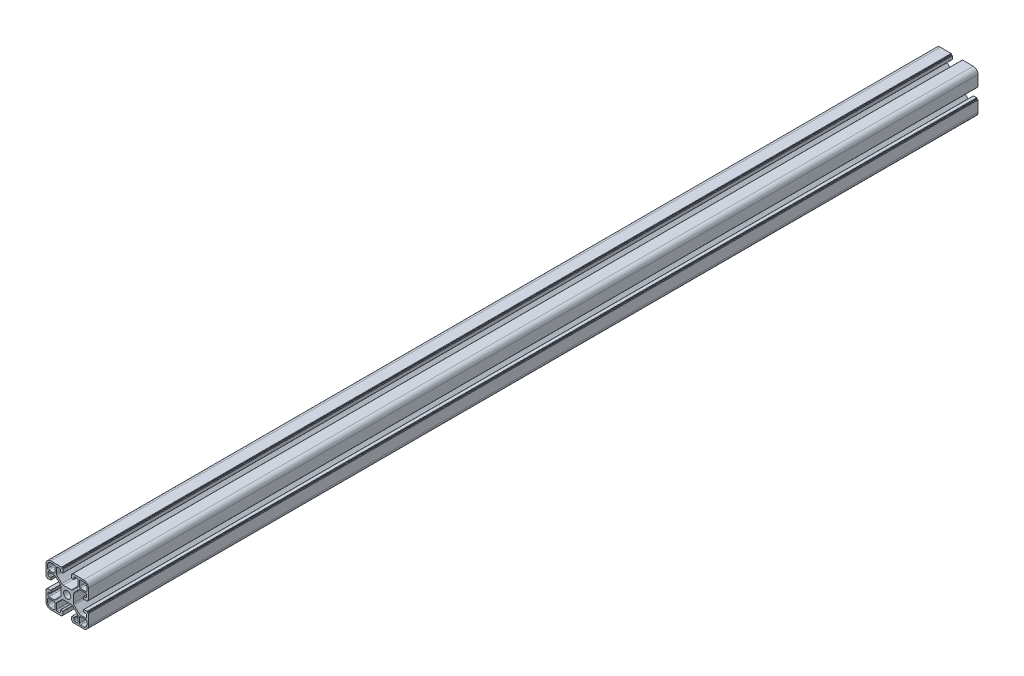
from build123d import *

# Parameters (mm, degrees)
SKETCH_1_R      = 3.4
EXTRUDE_1_DEPTH = 840


with BuildPart() as part:
    # 草图1 → 凸台-拉伸1 (new body)
    with BuildSketch(Plane.XY):
        with BuildLine():
            Line((5.1, -19.2), (5.1, -19.7))
            ThreePointArc((5.1, -19.7), (5.187867966, -19.912132034), (5.4, -20))
            Line((5.4, -20), (15.5, -20))
            ThreePointArc((15.5, -20), (18.681980515, -18.681980515), (20, -15.5))
            Line((20, -15.5), (20, -5.4))
            ThreePointArc((20, -5.4), (19.912132034, -5.187867966), (19.7, -5.1))
            Line((19.7, -5.1), (19.2, -5.1))
            ThreePointArc((19.2, -5.1), (19.058578644, -5.041421356), (19, -4.9))
            Line((19, -4.9), (19, -4.4))
            ThreePointArc((19, -4.4), (18.912132034, -4.187867966), (18.7, -4.1))
            Line((18.7, -4.1), (15.8, -4.1))
            ThreePointArc((15.8, -4.1), (15.587867966, -4.187867966), (15.5, -4.4))
            Line((15.5, -4.4), (15.5, -6.1))
            ThreePointArc((15.5, -6.1), (15.587867966, -6.312132034), (15.8, -6.4))
            Line((15.8, -6.4), (17.2, -6.4))
            ThreePointArc((17.2, -6.4), (17.907106781, -6.692893219), (18.2, -7.4))
            Line((18.2, -7.4), (18.2, -9.25))
            ThreePointArc((18.2, -9.25), (17.907106781, -9.957106781), (17.2, -10.25))
            Line((17.2, -10.25), (12.492640687, -10.25))
            ThreePointArc((12.492640687, -10.25), (11.727273822, -10.097759065), (11.078427125, -9.664213562))
            Line((11.078427125, -9.664213562), (6.585786438, -5.171572875))
            ThreePointArc((6.585786438, -5.171572875), (6.152240935, -4.522726178), (6, -3.757359313))
            Line((6, -3.757359313), (6, 3.757359313))
            ThreePointArc((6, 3.757359313), (6.152240935, 4.522726178), (6.585786438, 5.171572875))
            Line((6.585786438, 5.171572875), (11.078427125, 9.664213562))
            ThreePointArc((11.078427125, 9.664213562), (11.727273822, 10.097759065), (12.492640687, 10.25))
            Line((12.492640687, 10.25), (17.2, 10.25))
            ThreePointArc((17.2, 10.25), (17.907106781, 9.957106781), (18.2, 9.25))
            Line((18.2, 9.25), (18.2, 7.4))
            ThreePointArc((18.2, 7.4), (17.907106781, 6.692893219), (17.2, 6.4))
            Line((17.2, 6.4), (15.8, 6.4))
            ThreePointArc((15.8, 6.4), (15.587867966, 6.312132034), (15.5, 6.1))
            Line((15.5, 6.1), (15.5, 4.4))
            ThreePointArc((15.5, 4.4), (15.587867966, 4.187867966), (15.8, 4.1))
            Line((15.8, 4.1), (18.7, 4.1))
            ThreePointArc((18.7, 4.1), (18.912132034, 4.187867966), (19, 4.4))
            Line((19, 4.4), (19, 4.9))
            ThreePointArc((19, 4.9), (19.058578644, 5.041421356), (19.2, 5.1))
            Line((19.2, 5.1), (19.7, 5.1))
            ThreePointArc((19.7, 5.1), (19.912132034, 5.187867966), (20, 5.4))
            Line((20, 5.4), (20, 15.5))
            ThreePointArc((20, 15.5), (18.681980515, 18.681980515), (15.5, 20))
            Line((15.5, 20), (5.4, 20))
            ThreePointArc((5.4, 20), (5.187867966, 19.912132034), (5.1, 19.7))
            Line((5.1, 19.7), (5.1, 19.2))
            ThreePointArc((5.1, 19.2), (5.041421356, 19.058578644), (4.9, 19))
            Line((4.9, 19), (4.4, 19))
            ThreePointArc((4.4, 19), (4.187867966, 18.912132034), (4.1, 18.7))
            Line((4.1, 18.7), (4.1, 15.8))
            ThreePointArc((4.1, 15.8), (4.187867966, 15.587867966), (4.4, 15.5))
            Line((4.4, 15.5), (6.1, 15.5))
            ThreePointArc((6.1, 15.5), (6.312132034, 15.587867966), (6.4, 15.8))
            Line((6.4, 15.8), (6.4, 17.2))
            ThreePointArc((6.4, 17.2), (6.692893219, 17.907106781), (7.4, 18.2))
            Line((7.4, 18.2), (9.25, 18.2))
            ThreePointArc((9.25, 18.2), (9.957106781, 17.907106781), (10.25, 17.2))
            Line((10.25, 17.2), (10.25, 12.492640687))
            ThreePointArc((10.25, 12.492640687), (10.097759065, 11.727273822), (9.664213562, 11.078427125))
            Line((9.664213562, 11.078427125), (5.171572875, 6.585786438))
            ThreePointArc((5.171572875, 6.585786438), (4.522726178, 6.152240935), (3.757359313, 6))
            Line((3.757359313, 6), (-3.757359313, 6))
            ThreePointArc((-3.757359313, 6), (-4.522726178, 6.152240935), (-5.171572875, 6.585786438))
            Line((-5.171572875, 6.585786438), (-9.664213562, 11.078427125))
            ThreePointArc((-9.664213562, 11.078427125), (-10.097759065, 11.727273822), (-10.25, 12.492640687))
            Line((-10.25, 12.492640687), (-10.25, 17.2))
            ThreePointArc((-10.25, 17.2), (-9.957106781, 17.907106781), (-9.25, 18.2))
            Line((-9.25, 18.2), (-7.4, 18.2))
            ThreePointArc((-7.4, 18.2), (-6.692893219, 17.907106781), (-6.4, 17.2))
            Line((-6.4, 17.2), (-6.4, 15.8))
            ThreePointArc((-6.4, 15.8), (-6.312132034, 15.587867966), (-6.1, 15.5))
            Line((-6.1, 15.5), (-4.4, 15.5))
            ThreePointArc((-4.4, 15.5), (-4.187867966, 15.587867966), (-4.1, 15.8))
            Line((-4.1, 15.8), (-4.1, 18.7))
            ThreePointArc((-4.1, 18.7), (-4.187867966, 18.912132034), (-4.4, 19))
            Line((-4.4, 19), (-4.9, 19))
            ThreePointArc((-4.9, 19), (-5.041421356, 19.058578644), (-5.1, 19.2))
            Line((-5.1, 19.2), (-5.1, 19.7))
            ThreePointArc((-5.1, 19.7), (-5.187867966, 19.912132034), (-5.4, 20))
            Line((-5.4, 20), (-15.5, 20))
            ThreePointArc((-15.5, 20), (-18.681980515, 18.681980515), (-20, 15.5))
            Line((-20, 15.5), (-20, 5.4))
            ThreePointArc((-20, 5.4), (-19.912132034, 5.187867966), (-19.7, 5.1))
            Line((-19.7, 5.1), (-19.2, 5.1))
            ThreePointArc((-19.2, 5.1), (-19.058578644, 5.041421356), (-19, 4.9))
            Line((-19, 4.9), (-19, 4.4))
            ThreePointArc((-19, 4.4), (-18.912132034, 4.187867966), (-18.7, 4.1))
            Line((-18.7, 4.1), (-15.8, 4.1))
            ThreePointArc((-15.8, 4.1), (-15.587867966, 4.187867966), (-15.5, 4.4))
            Line((-15.5, 4.4), (-15.5, 6.1))
            ThreePointArc((-15.5, 6.1), (-15.587867966, 6.312132034), (-15.8, 6.4))
            Line((-15.8, 6.4), (-17.2, 6.4))
            ThreePointArc((-17.2, 6.4), (-17.907106781, 6.692893219), (-18.2, 7.4))
            Line((-18.2, 7.4), (-18.2, 9.25))
            ThreePointArc((-18.2, 9.25), (-17.907106781, 9.957106781), (-17.2, 10.25))
            Line((-17.2, 10.25), (-12.492640687, 10.25))
            ThreePointArc((-12.492640687, 10.25), (-11.727273822, 10.097759065), (-11.078427125, 9.664213562))
            Line((-11.078427125, 9.664213562), (-6.585786438, 5.171572875))
            ThreePointArc((-6.585786438, 5.171572875), (-6.152240935, 4.522726178), (-6, 3.757359313))
            Line((-6, 3.757359313), (-6, -3.757359313))
            ThreePointArc((-6, -3.757359313), (-6.152240935, -4.522726178), (-6.585786438, -5.171572875))
            Line((-6.585786438, -5.171572875), (-11.078427125, -9.664213562))
            ThreePointArc((-11.078427125, -9.664213562), (-11.727273822, -10.097759065), (-12.492640687, -10.25))
            Line((-12.492640687, -10.25), (-17.2, -10.25))
            ThreePointArc((-17.2, -10.25), (-17.907106781, -9.957106781), (-18.2, -9.25))
            Line((-18.2, -9.25), (-18.2, -7.4))
            ThreePointArc((-18.2, -7.4), (-17.907106781, -6.692893219), (-17.2, -6.4))
            Line((-17.2, -6.4), (-15.8, -6.4))
            ThreePointArc((-15.8, -6.4), (-15.587867966, -6.312132034), (-15.5, -6.1))
            Line((-15.5, -6.1), (-15.5, -4.4))
            ThreePointArc((-15.5, -4.4), (-15.587867966, -4.187867966), (-15.8, -4.1))
            Line((-15.8, -4.1), (-18.7, -4.1))
            ThreePointArc((-18.7, -4.1), (-18.912132034, -4.187867966), (-19, -4.4))
            Line((-19, -4.4), (-19, -4.9))
            ThreePointArc((-19, -4.9), (-19.058578644, -5.041421356), (-19.2, -5.1))
            Line((-19.2, -5.1), (-19.7, -5.1))
            ThreePointArc((-19.7, -5.1), (-19.912132034, -5.187867966), (-20, -5.4))
            Line((-20, -5.4), (-20, -15.5))
            ThreePointArc((-20, -15.5), (-18.681980515, -18.681980515), (-15.5, -20))
            Line((-15.5, -20), (-5.4, -20))
            ThreePointArc((-5.4, -20), (-5.187867966, -19.912132034), (-5.1, -19.7))
            Line((-5.1, -19.7), (-5.1, -19.2))
            ThreePointArc((-5.1, -19.2), (-5.041421356, -19.058578644), (-4.9, -19))
            Line((-4.9, -19), (-4.4, -19))
            ThreePointArc((-4.4, -19), (-4.201259622, -18.973110567), (-4.1, -18.8))
            Line((-4.1, -18.8), (-4.1, -15.8))
            ThreePointArc((-4.1, -15.8), (-4.187867966, -15.587867966), (-4.4, -15.5))
            Line((-4.4, -15.5), (-6.1, -15.5))
            ThreePointArc((-6.1, -15.5), (-6.312132034, -15.587867966), (-6.4, -15.8))
            Line((-6.4, -15.8), (-6.4, -17.2))
            ThreePointArc((-6.4, -17.2), (-6.692893219, -17.907106781), (-7.4, -18.2))
            Line((-7.4, -18.2), (-9.25, -18.2))
            ThreePointArc((-9.25, -18.2), (-9.957106781, -17.907106781), (-10.25, -17.2))
            Line((-10.25, -17.2), (-10.25, -12.492640687))
            ThreePointArc((-10.25, -12.492640687), (-10.097759065, -11.727273822), (-9.664213562, -11.078427125))
            Line((-9.664213562, -11.078427125), (-5.171572875, -6.585786438))
            ThreePointArc((-5.171572875, -6.585786438), (-4.522726178, -6.152240935), (-3.757359313, -6))
            Line((-3.757359313, -6), (3.757359313, -6))
            ThreePointArc((3.757359313, -6), (4.522726178, -6.152240935), (5.171572875, -6.585786438))
            Line((5.171572875, -6.585786438), (9.664213562, -11.078427125))
            ThreePointArc((9.664213562, -11.078427125), (10.097759065, -11.727273822), (10.25, -12.492640687))
            Line((10.25, -12.492640687), (10.25, -17.2))
            ThreePointArc((10.25, -17.2), (9.957106781, -17.907106781), (9.25, -18.2))
            Line((9.25, -18.2), (7.4, -18.2))
            ThreePointArc((7.4, -18.2), (6.692893219, -17.907106781), (6.4, -17.2))
            Line((6.4, -17.2), (6.4, -15.8))
            ThreePointArc((6.4, -15.8), (6.312132034, -15.587867966), (6.1, -15.5))
            Line((6.1, -15.5), (4.4, -15.5))
            ThreePointArc((4.4, -15.5), (4.187867966, -15.587867966), (4.1, -15.8))
            Line((4.1, -15.8), (4.1, -18.8))
            ThreePointArc((4.1, -18.8), (4.201259622, -18.973110567), (4.4, -19))
            Line((4.4, -19), (4.9, -19))
            ThreePointArc((4.9, -19), (5.041421356, -19.058578644), (5.1, -19.2))
        make_face()
        Circle(SKETCH_1_R, mode=Mode.SUBTRACT)
        with BuildLine():
            Line((12.55, 18.5), (15.5, 18.5))
            ThreePointArc((15.5, 18.5), (17.621320344, 17.621320344), (18.5, 15.5))
            Line((18.5, 15.5), (18.5, 12.55))
            ThreePointArc((18.5, 12.55), (18.207106781, 11.842893219), (17.5, 11.55))
            Line((17.5, 11.55), (12.55, 11.55))
            ThreePointArc((12.55, 11.55), (11.842893219, 11.842893219), (11.55, 12.55))
            Line((11.55, 12.55), (11.55, 17.5))
            ThreePointArc((11.55, 17.5), (11.842893219, 18.207106781), (12.55, 18.5))
        make_face(mode=Mode.SUBTRACT)
        with BuildLine():
            Line((-11.55, 17.5), (-11.55, 12.55))
            ThreePointArc((-11.55, 12.55), (-11.842893219, 11.842893219), (-12.55, 11.55))
            Line((-12.55, 11.55), (-17.5, 11.55))
            ThreePointArc((-17.5, 11.55), (-18.207106781, 11.842893219), (-18.5, 12.55))
            Line((-18.5, 12.55), (-18.5, 15.5))
            ThreePointArc((-18.5, 15.5), (-17.621320344, 17.621320344), (-15.5, 18.5))
            Line((-15.5, 18.5), (-12.55, 18.5))
            ThreePointArc((-12.55, 18.5), (-11.842893219, 18.207106781), (-11.55, 17.5))
        make_face(mode=Mode.SUBTRACT)
        with BuildLine():
            Line((-12.55, -18.5), (-15.5, -18.5))
            ThreePointArc((-15.5, -18.5), (-17.621320344, -17.621320344), (-18.5, -15.5))
            Line((-18.5, -15.5), (-18.5, -12.55))
            ThreePointArc((-18.5, -12.55), (-18.207106781, -11.842893219), (-17.5, -11.55))
            Line((-17.5, -11.55), (-12.55, -11.55))
            ThreePointArc((-12.55, -11.55), (-11.842893219, -11.842893219), (-11.55, -12.55))
            Line((-11.55, -12.55), (-11.55, -17.5))
            ThreePointArc((-11.55, -17.5), (-11.842893219, -18.207106781), (-12.55, -18.5))
        make_face(mode=Mode.SUBTRACT)
        with BuildLine():
            Line((11.55, -17.5), (11.55, -12.55))
            ThreePointArc((11.55, -12.55), (11.842893219, -11.842893219), (12.55, -11.55))
            Line((12.55, -11.55), (17.5, -11.55))
            ThreePointArc((17.5, -11.55), (18.207106781, -11.842893219), (18.5, -12.55))
            Line((18.5, -12.55), (18.5, -15.5))
            ThreePointArc((18.5, -15.5), (17.621320344, -17.621320344), (15.5, -18.5))
            Line((15.5, -18.5), (12.55, -18.5))
            ThreePointArc((12.55, -18.5), (11.842893219, -18.207106781), (11.55, -17.5))
        make_face(mode=Mode.SUBTRACT)
    extrude(amount=EXTRUDE_1_DEPTH)


solid = part.part
